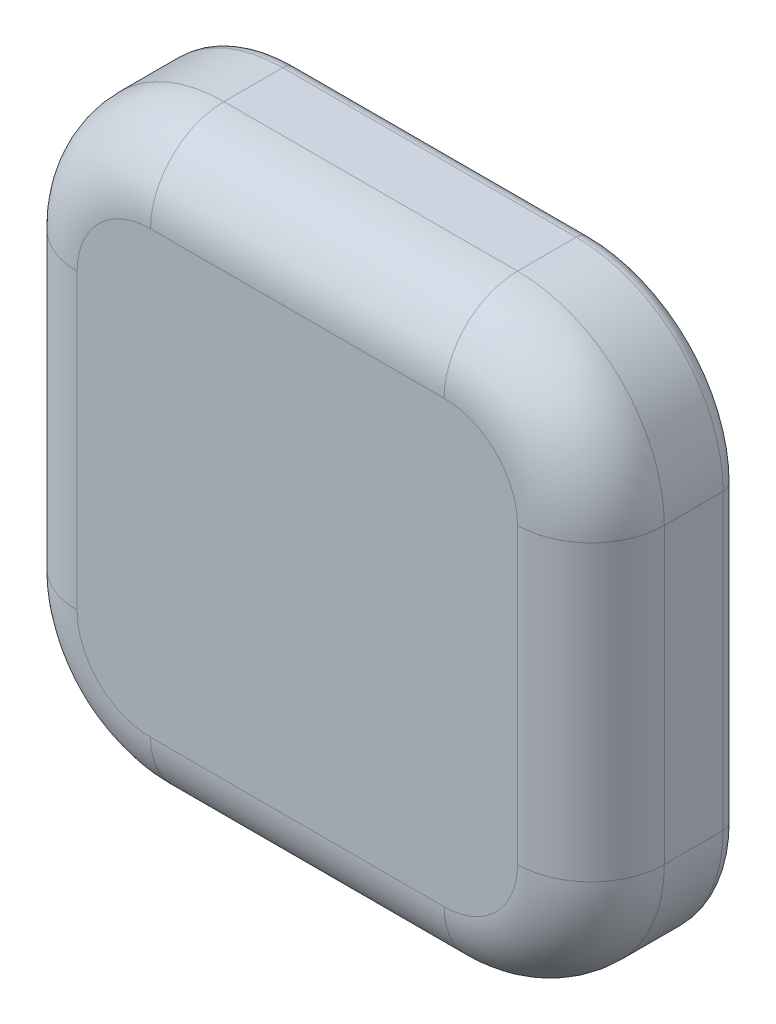
from build123d import *

# Parameters (mm, degrees)
ESBO_O1_W                = 8.5
ESBO_O1_H                = 8.5
ESBO_O1_W_2              = 3.29
ESBO_O1_H_2              = 3.29
RESSALTO_EXTRUS_O1_DEPTH = 7.3
ESBO_O2_W                = 40
ESBO_O2_H                = 40
RESSALTO_EXTRUS_O2_DEPTH = 10
FILETE1_R                = 10
FILETE2_R                = 10
FILETE3_R                = 5
ESBO_O3_W                = 0.5
ESBO_O3_H                = 1.5
ESBO_O3_W_2              = 1.5
ESBO_O3_H_2              = 0.5
CORTE_EXTRUS_O1_DEPTH    = 5
FILETE4_R                = 1


with BuildPart() as part:
    # Esboço1 → Ressalto-extrusão1 (new body)
    with BuildSketch(Plane.XY):
        Rectangle(ESBO_O1_W, ESBO_O1_H)
        Rectangle(ESBO_O1_W_2, ESBO_O1_H_2, mode=Mode.SUBTRACT)
    extrude(amount=RESSALTO_EXTRUS_O1_DEPTH)

    # Esboço2 → Ressalto-extrusão2 (add)
    with BuildSketch(Plane.XY.offset(7.3)):
        Rectangle(ESBO_O2_W, ESBO_O2_H)
    extrude(amount=RESSALTO_EXTRUS_O2_DEPTH)

    # Filete1
    # the kernel refuses this fillet: 10 mm, written as the material it adds along each edge
    with BuildSketch(Plane(origin=(-4.25, -4.25, 7.3), x_dir=(-1, 0, 0), z_dir=(0, 1, 0)), Plane(origin=(4.25, -4.25, 7.3), x_dir=(0, -1, 0), z_dir=(-1, 0, 0)), Plane(origin=(4.25, 4.25, 7.3), x_dir=(1, 0, 0), z_dir=(0, -1, 0)), Plane(origin=(-4.25, 4.25, 7.3), x_dir=(0, 1, 0), z_dir=(1, 0, 0))) as filete1_piece_1:
        with BuildLine():
            CenterArc((9.628603222, -10), FILETE1_R, 90, 74.335733149)
            Line((0, -7.3), (-0.192572064, -7.246))
            ThreePointArc((-0.192572064, -7.246), (-0.2, -3.65), (-0.2, 0))
            Line((-0.2, 0), (0, 0.2))
            Line((0, 0.2), (9.628603222, 0.2))
            Line((9.628603222, 0.2), (9.628603222, 0))
        make_face()
    extrude(amount=8.5)
    with BuildSketch(Plane(origin=(4.25, -4.25, 7.3), x_dir=(0, -1, 0), z_dir=(-1, 0, 0))) as filete1_piece_2a_section:
        with BuildLine():
            CenterArc((9.628603222, -10), FILETE1_R, 90, 74.335733149)
            Line((0, -7.3), (-0.192572064, -7.246))
            ThreePointArc((-0.192572064, -7.246), (-0.2, -3.65), (-0.2, 0))
            Line((-0.2, 0), (0, 0.2))
            Line((0, 0.2), (9.628603222, 0.2))
            Line((9.628603222, 0.2), (9.628603222, 0))
        make_face()
    filete1_piece_2a = extrude(amount=32.571508054, mode=Mode.PRIVATE)
    filete1_piece_2a = split(filete1_piece_2a, bisect_by=Plane(origin=(-20, -6.528048656, 5.446397175), z_dir=(1, 0, 0)), keep=Keep.TOP, mode=Mode.PRIVATE)
    filete1_piece_2a = split(filete1_piece_2a, bisect_by=Plane(origin=(-4.25, -6.528048656, 5.446397175), z_dir=(-1, 0, 0)), keep=Keep.TOP, mode=Mode.PRIVATE)
    with BuildSketch(Plane(origin=(-4.25, -28.321508054, 7.3), x_dir=(-1, 0, 0), z_dir=(0, 1, 0))) as filete1_piece_2b_section:
        with BuildLine():
            CenterArc((9.628603222, -10), FILETE1_R, 90, 74.335733149)
            Line((0, -7.3), (-0.192572064, -7.246))
            ThreePointArc((-0.192572064, -7.246), (-0.2, -3.65), (-0.2, 0))
            Line((-0.2, 0), (0, 0.2))
            Line((0, 0.2), (9.628603222, 0.2))
            Line((9.628603222, 0.2), (9.628603222, 0))
        make_face()
    filete1_piece_2b = extrude(amount=32.571508054, mode=Mode.PRIVATE)
    filete1_piece_2b = split(filete1_piece_2b, bisect_by=Plane(origin=(-6.528048656, -20, 5.446397175), z_dir=(0, 1, 0)), keep=Keep.TOP, mode=Mode.PRIVATE)
    filete1_piece_2b = split(filete1_piece_2b, bisect_by=Plane(origin=(-6.528048656, -4.25, 5.446397175), z_dir=(0, -1, 0)), keep=Keep.TOP, mode=Mode.PRIVATE)
    filete1_piece_2 = filete1_piece_2a & filete1_piece_2b
    add(filete1_piece_2)
    with BuildSketch(Plane(origin=(-28.321508054, 4.25, 7.3), x_dir=(0, 1, 0), z_dir=(1, 0, 0))) as filete1_piece_3a_section:
        with BuildLine():
            CenterArc((9.628603222, -10), FILETE1_R, 90, 74.335733149)
            Line((0, -7.3), (-0.192572064, -7.246))
            ThreePointArc((-0.192572064, -7.246), (-0.2, -3.65), (-0.2, 0))
            Line((-0.2, 0), (0, 0.2))
            Line((0, 0.2), (9.628603222, 0.2))
            Line((9.628603222, 0.2), (9.628603222, 0))
        make_face()
    filete1_piece_3a = extrude(amount=32.571508054, mode=Mode.PRIVATE)
    filete1_piece_3a = split(filete1_piece_3a, bisect_by=Plane(origin=(-20, 6.528048656, 5.446397175), z_dir=(1, 0, 0)), keep=Keep.TOP, mode=Mode.PRIVATE)
    filete1_piece_3a = split(filete1_piece_3a, bisect_by=Plane(origin=(-4.25, 6.528048656, 5.446397175), z_dir=(-1, 0, 0)), keep=Keep.TOP, mode=Mode.PRIVATE)
    with BuildSketch(Plane(origin=(-4.25, -4.25, 7.3), x_dir=(-1, 0, 0), z_dir=(0, 1, 0))) as filete1_piece_3b_section:
        with BuildLine():
            CenterArc((9.628603222, -10), FILETE1_R, 90, 74.335733149)
            Line((0, -7.3), (-0.192572064, -7.246))
            ThreePointArc((-0.192572064, -7.246), (-0.2, -3.65), (-0.2, 0))
            Line((-0.2, 0), (0, 0.2))
            Line((0, 0.2), (9.628603222, 0.2))
            Line((9.628603222, 0.2), (9.628603222, 0))
        make_face()
    filete1_piece_3b = extrude(amount=32.571508054, mode=Mode.PRIVATE)
    filete1_piece_3b = split(filete1_piece_3b, bisect_by=Plane(origin=(-6.528048656, 20, 5.446397175), z_dir=(0, -1, 0)), keep=Keep.TOP, mode=Mode.PRIVATE)
    filete1_piece_3b = split(filete1_piece_3b, bisect_by=Plane(origin=(-6.528048656, 4.25, 5.446397175), z_dir=(0, 1, 0)), keep=Keep.TOP, mode=Mode.PRIVATE)
    filete1_piece_3 = filete1_piece_3a & filete1_piece_3b
    add(filete1_piece_3)
    with BuildSketch(Plane(origin=(4.25, 4.25, 7.3), x_dir=(1, 0, 0), z_dir=(0, -1, 0))) as filete1_piece_4a_section:
        with BuildLine():
            CenterArc((9.628603222, -10), FILETE1_R, 90, 74.335733149)
            Line((0, -7.3), (-0.192572064, -7.246))
            ThreePointArc((-0.192572064, -7.246), (-0.2, -3.65), (-0.2, 0))
            Line((-0.2, 0), (0, 0.2))
            Line((0, 0.2), (9.628603222, 0.2))
            Line((9.628603222, 0.2), (9.628603222, 0))
        make_face()
    filete1_piece_4a = extrude(amount=32.571508054, mode=Mode.PRIVATE)
    filete1_piece_4a = split(filete1_piece_4a, bisect_by=Plane(origin=(6.528048656, -20, 5.446397175), z_dir=(0, 1, 0)), keep=Keep.TOP, mode=Mode.PRIVATE)
    filete1_piece_4a = split(filete1_piece_4a, bisect_by=Plane(origin=(6.528048656, -4.25, 5.446397175), z_dir=(0, -1, 0)), keep=Keep.TOP, mode=Mode.PRIVATE)
    with BuildSketch(Plane(origin=(28.321508054, -4.25, 7.3), x_dir=(0, -1, 0), z_dir=(-1, 0, 0))) as filete1_piece_4b_section:
        with BuildLine():
            CenterArc((9.628603222, -10), FILETE1_R, 90, 74.335733149)
            Line((0, -7.3), (-0.192572064, -7.246))
            ThreePointArc((-0.192572064, -7.246), (-0.2, -3.65), (-0.2, 0))
            Line((-0.2, 0), (0, 0.2))
            Line((0, 0.2), (9.628603222, 0.2))
            Line((9.628603222, 0.2), (9.628603222, 0))
        make_face()
    filete1_piece_4b = extrude(amount=32.571508054, mode=Mode.PRIVATE)
    filete1_piece_4b = split(filete1_piece_4b, bisect_by=Plane(origin=(20, -6.528048656, 5.446397175), z_dir=(-1, 0, 0)), keep=Keep.TOP, mode=Mode.PRIVATE)
    filete1_piece_4b = split(filete1_piece_4b, bisect_by=Plane(origin=(4.25, -6.528048656, 5.446397175), z_dir=(1, 0, 0)), keep=Keep.TOP, mode=Mode.PRIVATE)
    filete1_piece_4 = filete1_piece_4a & filete1_piece_4b
    add(filete1_piece_4)
    with BuildSketch(Plane(origin=(-4.25, 4.25, 7.3), x_dir=(0, 1, 0), z_dir=(1, 0, 0))) as filete1_piece_5a_section:
        with BuildLine():
            CenterArc((9.628603222, -10), FILETE1_R, 90, 74.335733149)
            Line((0, -7.3), (-0.192572064, -7.246))
            ThreePointArc((-0.192572064, -7.246), (-0.2, -3.65), (-0.2, 0))
            Line((-0.2, 0), (0, 0.2))
            Line((0, 0.2), (9.628603222, 0.2))
            Line((9.628603222, 0.2), (9.628603222, 0))
        make_face()
    filete1_piece_5a = extrude(amount=32.571508054, mode=Mode.PRIVATE)
    filete1_piece_5a = split(filete1_piece_5a, bisect_by=Plane(origin=(20, 6.528048656, 5.446397175), z_dir=(-1, 0, 0)), keep=Keep.TOP, mode=Mode.PRIVATE)
    filete1_piece_5a = split(filete1_piece_5a, bisect_by=Plane(origin=(4.25, 6.528048656, 5.446397175), z_dir=(1, 0, 0)), keep=Keep.TOP, mode=Mode.PRIVATE)
    with BuildSketch(Plane(origin=(4.25, 28.321508054, 7.3), x_dir=(1, 0, 0), z_dir=(0, -1, 0))) as filete1_piece_5b_section:
        with BuildLine():
            CenterArc((9.628603222, -10), FILETE1_R, 90, 74.335733149)
            Line((0, -7.3), (-0.192572064, -7.246))
            ThreePointArc((-0.192572064, -7.246), (-0.2, -3.65), (-0.2, 0))
            Line((-0.2, 0), (0, 0.2))
            Line((0, 0.2), (9.628603222, 0.2))
            Line((9.628603222, 0.2), (9.628603222, 0))
        make_face()
    filete1_piece_5b = extrude(amount=32.571508054, mode=Mode.PRIVATE)
    filete1_piece_5b = split(filete1_piece_5b, bisect_by=Plane(origin=(6.528048656, 20, 5.446397175), z_dir=(0, -1, 0)), keep=Keep.TOP, mode=Mode.PRIVATE)
    filete1_piece_5b = split(filete1_piece_5b, bisect_by=Plane(origin=(6.528048656, 4.25, 5.446397175), z_dir=(0, 1, 0)), keep=Keep.TOP, mode=Mode.PRIVATE)
    filete1_piece_5 = filete1_piece_5a & filete1_piece_5b
    add(filete1_piece_5)

    # Filete2
    filete2_edges = [part.edges().sort_by_distance(p)[0] for p in [
        (-20, 20, 12.3),
        (-20, -20, 12.3),
        (20, -20, 12.3),
        (20, 20, 12.3),
    ]]
    fillet(filete2_edges, radius=FILETE2_R)

    # Filete3
    filete3_edges = [part.edges().sort_by_distance(p)[0] for p in [
        (0, 20, 17.3),
        (20, 0, 17.3),
        (-20, 0, 17.3),
        (0, -20, 17.3),
        (-17.071067812, 17.071067812, 17.3),
        (-17.071067812, -17.071067812, 17.3),
        (17.071067812, -17.071067812, 17.3),
        (17.071067812, 17.071067812, 17.3),
    ]]
    fillet(filete3_edges, radius=FILETE3_R)

    # Esboço3 → Corte-extrusão1 (cut)
    with BuildSketch(Plane(origin=(0, 0, 0), x_dir=(-1, 0, 0), z_dir=(0, 0, -1))):
        with Locations((0, 2.395)):
            Rectangle(ESBO_O3_W, ESBO_O3_H)
        with Locations((0, -2.395)):
            Rectangle(ESBO_O3_W, ESBO_O3_H)
        with Locations((2.395, 0)):
            Rectangle(ESBO_O3_W_2, ESBO_O3_H_2)
        with Locations((-2.395, 0)):
            Rectangle(ESBO_O3_W_2, ESBO_O3_H_2)
    extrude(amount=-CORTE_EXTRUS_O1_DEPTH, mode=Mode.SUBTRACT)

    # Filete4
    filete4_edges = [part.edges().sort_by_distance(p)[0] for p in [
        (0, 20, 7.3),
        (-20, 0, 7.3),
        (20, 0, 7.3),
        (0, -20, 7.3),
        (-17.071067812, 17.071067812, 7.3),
        (-17.071067812, -17.071067812, 7.3),
        (17.071067812, -17.071067812, 7.3),
        (17.071067812, 17.071067812, 7.3),
    ]]
    fillet(filete4_edges, radius=FILETE4_R)


solid = part.part
